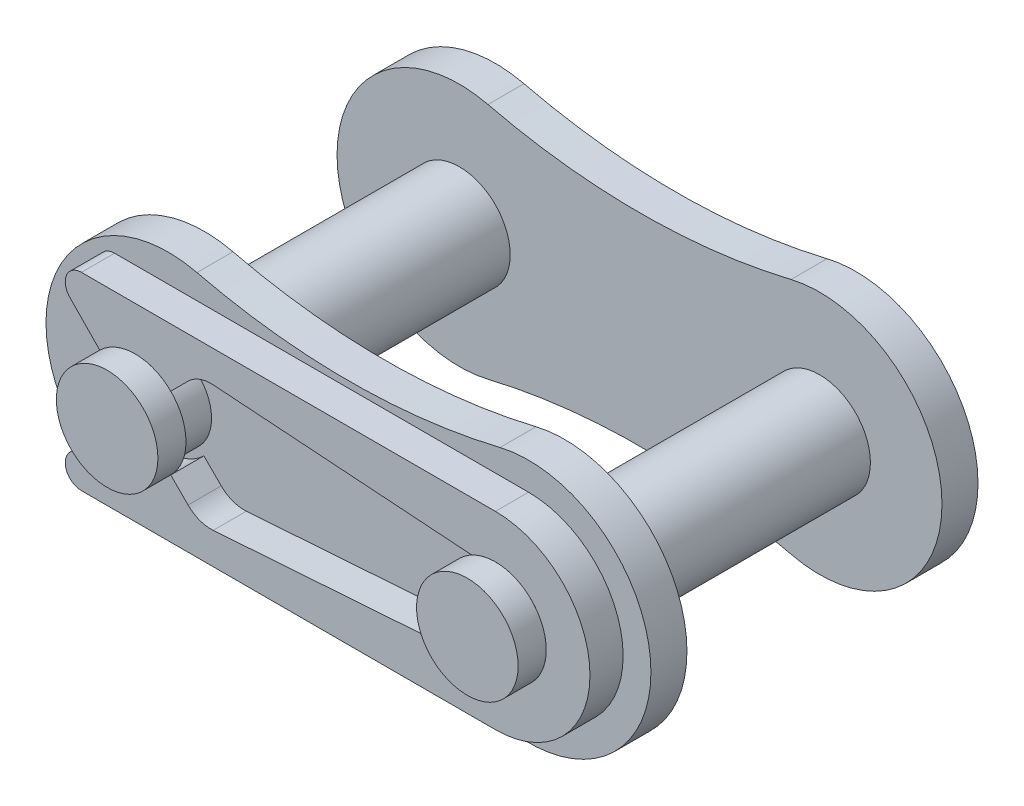
from build123d import *

# Parameters (mm, degrees)
SKETCH4_R                  = 3.8862
SKETCH4_R_2                = 1.8161
BOSS_EXTRUDE1_DEPTH        = 3.175
SKETCH5_R                  = 1.7907
BOSS_EXTRUDE2_DEPTH        = 1.27
LPATTERN1_COUNT            = 2
LPATTERN1_PITCH            = 12.7
SKETCH7_R                  = 1.7907
BOSS_EXTRUDE3_DEPTH        = 1.27
MIRROR1_START              = 4.4958
MIRROR1_OUTLINE_R          = 1.7907
MIRROR1_DEPTH              = 1.27
BOSS_EXTRUDE4_DEPTH        = 7.9248
BOSS_EXTRUDE4_DEPTH_BACK   = 6.7564
SKETCH8_R                  = 1.7907
BOSS_EXTRUDE4_2_DEPTH      = 7.9248
BOSS_EXTRUDE4_2_DEPTH_BACK = 6.7564
BOSS_EXTRUDE5_DEPTH        = 1.1684
SKETCH12_R                 = 1.7907
SKETCH12_R_2               = 1.522095
CUT_EXTRUDE1_DEPTH         = 1.1684


# Read off the part's stored shape, not the designer's step: Mirror1
with BuildPart() as part:
    # Sketch4 → Boss-Extrude1 (new, symmetric)
    with BuildSketch(Plane.XY):
        with Locations((6.35, 0)):
            Circle(SKETCH4_R)
        with Locations((6.35, 0)):
            Circle(SKETCH4_R_2, mode=Mode.SUBTRACT)
    extrude(amount=BOSS_EXTRUDE1_DEPTH, both=True)


with BuildPart() as body_2:
    # Sketch5 → Boss-Extrude2 (new body)
    with BuildSketch(Plane.XY.offset(3.175)):
        with BuildLine():
            ThreePointArc((-5.229673653, 4.772466209), (-11.2522, 0), (-5.229673653, -4.772466209))
            ThreePointArc((-5.229673653, -4.772466209), (0, -4.16687), (5.229673653, -4.772466209))
            ThreePointArc((5.229673653, -4.772466209), (11.2522, 0), (5.229673653, 4.772466209))
            ThreePointArc((5.229673653, 4.772466209), (0, 4.16687), (-5.229673653, 4.772466209))
        make_face()
        with Locations((-6.35, 0)):
            Circle(SKETCH5_R, mode=Mode.SUBTRACT)
        with Locations((6.35, 0)):
            Circle(SKETCH5_R, mode=Mode.SUBTRACT)
    extrude(amount=BOSS_EXTRUDE2_DEPTH)


with BuildPart() as lpattern1_1:
    # LPattern1: pattern copy
    add(part.part.moved(Location(Vector(1, 0, 0) * (1 * LPATTERN1_PITCH))))


with BuildPart() as body_4:
    # Sketch7 → Boss-Extrude3 (new body)
    with BuildSketch(Plane.XY.offset(-4.4958)):
        with BuildLine():
            ThreePointArc((7.357211383, 4.194707265), (2.036064, 0), (7.357211383, -4.194707265))
            ThreePointArc((7.357211383, -4.194707265), (12.7, -3.562254201), (18.042788617, -4.194707265))
            ThreePointArc((18.042788617, -4.194707265), (23.363936, 0), (18.042788617, 4.194707265))
            ThreePointArc((18.042788617, 4.194707265), (12.7, 3.562254201), (7.357211383, 4.194707265))
        make_face()
        with Locations((6.35, 0)):
            Circle(SKETCH7_R, mode=Mode.SUBTRACT)
        with Locations((19.05, 0)):
            Circle(SKETCH7_R, mode=Mode.SUBTRACT)
    extrude(amount=-BOSS_EXTRUDE3_DEPTH)


with BuildPart() as body_5:
    # Mirror1 outline → Mirror1 (new body)
    with BuildSketch(Plane.XY.offset(MIRROR1_START)):
        with BuildLine():
            ThreePointArc((18.042788617, -4.194707265), (23.363936, 0), (18.042788617, 4.194707265))
            ThreePointArc((18.042788617, 4.194707265), (12.7, 3.562254201), (7.357211383, 4.194707265))
            ThreePointArc((7.357211383, 4.194707265), (2.036064, 0), (7.357211383, -4.194707265))
            ThreePointArc((7.357211383, -4.194707265), (12.7, -3.562254201), (18.042788617, -4.194707265))
        make_face()
        with Locations((6.35, 0)):
            Circle(MIRROR1_OUTLINE_R, mode=Mode.SUBTRACT)
        with Locations((19.05, 0)):
            Circle(MIRROR1_OUTLINE_R, mode=Mode.SUBTRACT)
    extrude(amount=MIRROR1_DEPTH)


with BuildPart() as body_3:
    # Sketch8 → Boss-Extrude4 (new, two sides: drawn at the far end of the back side and taken through both)
    with BuildSketch(Plane.XY.offset(-BOSS_EXTRUDE4_DEPTH_BACK)):
        with Locations((6.35, 0)):
            Circle(SKETCH8_R)
    extrude(amount=BOSS_EXTRUDE4_DEPTH + BOSS_EXTRUDE4_DEPTH_BACK)


with BuildPart() as body_4_2:
    # Sketch8 → Boss-Extrude4 2 (new, two sides: drawn at the far end of the back side and taken through both)
    with BuildSketch(Plane.XY.offset(-BOSS_EXTRUDE4_2_DEPTH_BACK)):
        with Locations((19.05, 0)):
            Circle(SKETCH8_R)
    extrude(amount=BOSS_EXTRUDE4_2_DEPTH + BOSS_EXTRUDE4_2_DEPTH_BACK)


with BuildPart() as body_5_2:
    # Sketch10 → Boss-Extrude5 (new body)
    with BuildSketch(Plane.XY.offset(5.7658)):
        with BuildLine():
            Line((19.05, -3.333496), (4.453566335, -3.333496))
            ThreePointArc((4.453566335, -3.333496), (3.927622666, -2.984474861), (4.044881806, -2.364246845))
            Line((4.044881806, -2.364246845), (5.287430585, -1.089825412))
            ThreePointArc((5.287430585, -1.089825412), (6.35, -1.522095), (7.412569415, -1.089825412))
            Line((7.412569415, -1.089825412), (8.212776406, -1.890032403))
            ThreePointArc((8.212776406, -1.890032403), (8.6202025, -2.152097673), (9.099621163, -2.221610071))
            Line((9.099621163, -2.221610071), (19.15617598, -1.518387253))
            ThreePointArc((19.15617598, -1.518387253), (20.572095, 0), (19.15617598, 1.518387253))
            Line((19.15617598, 1.518387253), (9.099621163, 2.221610071))
            ThreePointArc((9.099621163, 2.221610071), (8.6202025, 2.152097673), (8.212776406, 1.890032403))
            Line((8.212776406, 1.890032403), (7.412569415, 1.089825412))
            ThreePointArc((7.412569415, 1.089825412), (6.35, 1.522095), (5.287430585, 1.089825412))
            Line((5.287430585, 1.089825412), (4.044881806, 2.364246845))
            ThreePointArc((4.044881806, 2.364246845), (3.927622666, 2.984474861), (4.453566335, 3.333496))
            Line((4.453566335, 3.333496), (19.05, 3.333496))
            ThreePointArc((19.05, 3.333496), (22.383496, 0), (19.05, -3.333496))
        make_face()
    extrude(amount=BOSS_EXTRUDE5_DEPTH)


with BuildPart() as cut_extrude1_tool:
    # Sketch12 → Cut-Extrude1 (new body)
    # profile 1 of 2: a face of its own
    with BuildSketch(Plane.XY.offset(5.7658)):
        with Locations((6.35, 0)):
            Circle(SKETCH12_R)
        with Locations((6.35, 0)):
            Circle(SKETCH12_R_2, mode=Mode.SUBTRACT)
    # profile 2 of 2: a face of its own
    with BuildSketch(Plane.XY.offset(5.7658)):
        with Locations((19.05, 0)):
            Circle(SKETCH12_R)
        with Locations((19.05, 0)):
            Circle(SKETCH12_R_2, mode=Mode.SUBTRACT)
    extrude(amount=CUT_EXTRUDE1_DEPTH)


with BuildPart() as body_3_1:
    add(body_3.part)

    # Cut-Extrude1: cut by cut_extrude1_tool
    add(cut_extrude1_tool.part, mode=Mode.SUBTRACT)


with BuildPart() as body_4_2_1:
    add(body_4_2.part)

    # Cut-Extrude1: cut by cut_extrude1_tool
    add(cut_extrude1_tool.part, mode=Mode.SUBTRACT)


with BuildPart() as body_5_2_1:
    add(body_5_2.part)

    # Cut-Extrude1: cut by cut_extrude1_tool
    add(cut_extrude1_tool.part, mode=Mode.SUBTRACT)


with BuildPart() as body_4_1:
    add(body_4.part)

    # Combine3: union body 5, body 4 2, body 3
    add(body_5.part)
    add(body_4_2_1.part)
    add(body_3_1.part)


solid = Compound([body_5_2_1.part, body_4_1.part])
